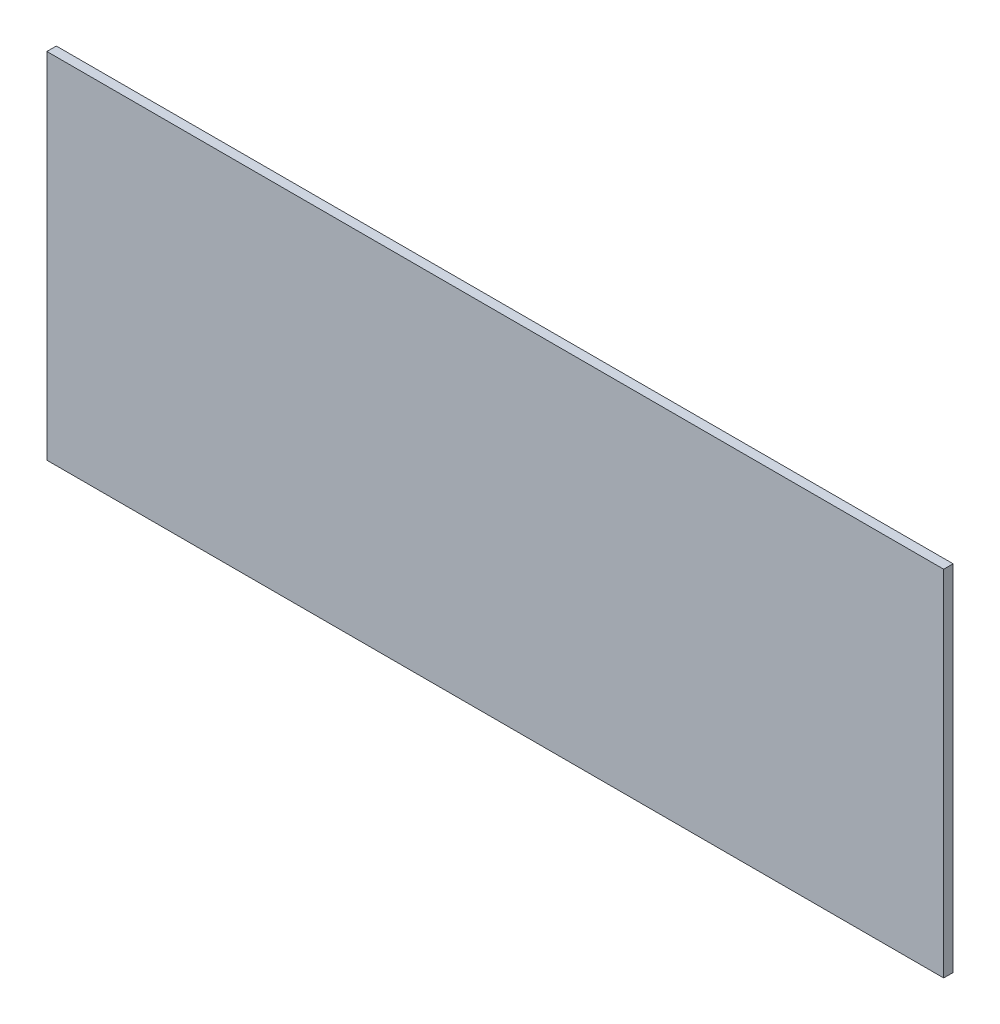
from build123d import *

# Parameters (mm, degrees)
ESQUISSE1_W        = 380
ESQUISSE1_H        = 150
BOSS_EXTRU_1_DEPTH = 4


with BuildPart() as part:
    # Esquisse1 → Boss.-Extru.1 (new body)
    with BuildSketch(Plane.XY):
        with Locations((-1.531306326, -52.107329843)):
            Rectangle(ESQUISSE1_W, ESQUISSE1_H)
    extrude(amount=BOSS_EXTRU_1_DEPTH)


solid = part.part
